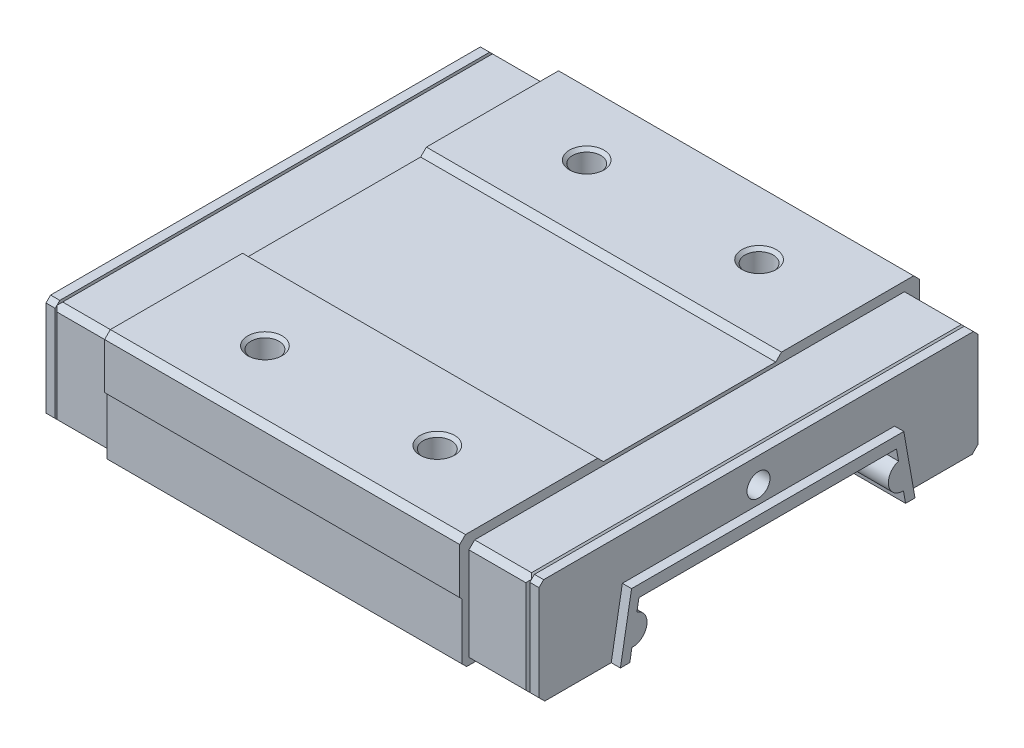
from build123d import *

# Parameters (mm, degrees)
RESSALTO_EXTRUS_O1_DEPTH      = 15.45
RESSALTO_EXTRUS_O1_DEPTH_BACK = 15.45
RESSALTO_EXTRUS_O2_DEPTH      = 6
RESSALTO_EXTRUS_O3_DEPTH      = 6
RESSALTO_EXTRUS_O4_DEPTH      = 22.25
RESSALTO_EXTRUS_O4_DEPTH_BACK = 22.25
CORTE_EXTRUS_O1_DEPTH         = 22.25
CORTE_EXTRUS_O1_DEPTH_BACK    = 22.25
ESBO_O10_W                    = 48.5
ESBO_O10_H                    = 44
CORTE_EXTRUS_O2_DEPTH         = 11
CORTE_EXTRUS_O3_DEPTH         = 20
CORTE_EXTRUS_O3_DEPTH_BACK    = 20
CORTE_EXTRUS_O4_DEPTH         = 20
CORTE_EXTRUS_O4_DEPTH_BACK    = 20
CORTE_EXTRUS_O5_DEPTH         = 10
CORTE_EXTRUS_O6_DEPTH         = 10
CORTE_EXTRUS_O7_DEPTH         = 10
CORTE_EXTRUS_O8_DEPTH         = 10
ESBO_O17_W                    = 2.5
ESBO_O17_H                    = 1
ESBO_O18_W                    = 2.5
ESBO_O18_H                    = 1


with BuildPart() as part:
    # Esboço1 → Ressalto-extrusão1 (new, two sides: drawn at the far end of the back side and taken through both)
    with BuildSketch(Plane(origin=(0, 0, 0), x_dir=(0, 0, -1), z_dir=(1, 0, 0)).offset(-RESSALTO_EXTRUS_O1_DEPTH_BACK)):
        Polygon((-20, 9.5), (-20, 5.5), (-19.8, 5.3), (-19.8, 0.4), (-19.4, 0), (19.4, 0), (19.8, 0.4), (19.8, 5.3), (20, 5.5), (20, 9.5), (19.5, 10), (8, 10), (7.5, 9.5), (-7.5, 9.5), (-8, 10), (-19.5, 10), align=None)
    extrude(amount=RESSALTO_EXTRUS_O1_DEPTH + RESSALTO_EXTRUS_O1_DEPTH_BACK)

    # Esboço2 → Ressalto-extrusão2 (add)
    with BuildSketch(Plane(origin=(-15.45, 0, 0), x_dir=(0, 0, -1), z_dir=(1, 0, 0))):
        Polygon((-19.2, 8.7), (-19.2, 0.6), (-18.6, 0), (18.6, 0), (19.2, 0.6), (19.2, 8.7), (18.7, 9.2), (-18.7, 9.2), align=None)
    extrude(amount=-RESSALTO_EXTRUS_O2_DEPTH)

    # Esboço3 → Ressalto-extrusão3 (add)
    with BuildSketch(Plane(origin=(15.45, 0, 0), x_dir=(0, 0, -1), z_dir=(1, 0, 0))):
        Polygon((-19.2, 8.7), (-19.2, 0.6), (-18.6, 0), (18.6, 0), (19.2, 0.6), (19.2, 8.7), (18.7, 9.2), (-18.7, 9.2), align=None)
    extrude(amount=RESSALTO_EXTRUS_O3_DEPTH)

    # Esboço4 → Ressalto-extrusão4 (add, two sides: drawn at the far end of the back side and taken through both)
    with BuildSketch(Plane(origin=(0, 0, 0), x_dir=(0, 0, -1), z_dir=(1, 0, 0)).offset(-RESSALTO_EXTRUS_O4_DEPTH_BACK)):
        Polygon((-12.816, 0), (12.816, 0), (11.846201606, 5.5), (-11.846201606, 5.5), align=None)
    extrude(amount=RESSALTO_EXTRUS_O4_DEPTH + RESSALTO_EXTRUS_O4_DEPTH_BACK)

    # Esboço5 → Corte-extrusão1 (cut, two sides: drawn at the far end of the back side and taken through both)
    with BuildSketch(Plane(origin=(0, 0, 0), x_dir=(0, 0, -1), z_dir=(1, 0, 0)).offset(-CORTE_EXTRUS_O1_DEPTH_BACK)):
        with BuildLine():
            Line((-12, 0), (12, 0))
            Line((12, 0), (11.814562479, 1.051668439))
            ThreePointArc((11.814562479, 1.051668439), (10.518990309, 2.082939778), (11.383714346, 3.495129625))
            Line((11.383714346, 3.495129625), (11.206528587, 4.5))
            Line((11.206528587, 4.5), (-11.206528587, 4.5))
            Line((-11.206528587, 4.5), (-11.383714346, 3.495129625))
            ThreePointArc((-11.383714346, 3.495129625), (-10.518990309, 2.082939778), (-11.814562479, 1.051668439))
            Line((-11.814562479, 1.051668439), (-12, 0))
        make_face()
    extrude(amount=CORTE_EXTRUS_O1_DEPTH + CORTE_EXTRUS_O1_DEPTH_BACK, mode=Mode.SUBTRACT)

    # Esboço6 → Corte-Revolução1 (revolve, cut)
    with BuildSketch(Plane.XY.offset(14)):
        Polygon((7.5, 10), (9, 10), (8.7295, 9.7295), (8.7295, 5.8), (7.5, 5.090147844), align=None)
    revolve(axis=Axis((7.5, 5.090147844, 14), (0, 1, 0)), mode=Mode.SUBTRACT)

    # Esboço7 → Corte-Revolução2 (revolve, cut)
    with BuildSketch(Plane.XY.offset(-14)):
        Polygon((-7.5, 10), (-6, 10), (-6.2705, 9.7295), (-6.2705, 5.8), (-7.5, 5.090147844), align=None)
    revolve(axis=Axis((-7.5, 5.090147844, -14), (0, 1, 0)), mode=Mode.SUBTRACT)

    # Esboço8 → Corte-Revolução3 (revolve, cut)
    with BuildSketch(Plane.XY.offset(14)):
        Polygon((-7.5, 10), (-6, 10), (-6.2705, 9.7295), (-6.2705, 5.8), (-7.5, 5.090147844), align=None)
    revolve(axis=Axis((-7.5, 5.090147844, 14), (0, 1, 0)), mode=Mode.SUBTRACT)

    # Esboço9 → Corte-Revolução4 (revolve, cut)
    with BuildSketch(Plane.XY.offset(-14)):
        Polygon((7.5, 10), (9, 10), (8.7295, 9.7295), (8.7295, 5.8), (7.5, 5.090147844), align=None)
    revolve(axis=Axis((7.5, 5.090147844, -14), (0, 1, 0)), mode=Mode.SUBTRACT)

    # Esboço10 → Corte-extrusão2 (cut)
    with BuildSketch(Plane(origin=(0, 0, 0), x_dir=(1, 0, 0), z_dir=(0, 1, 0))):
        Rectangle(ESBO_O10_W, ESBO_O10_H)
        Polygon((-23.25, 19.1), (-23.25, -19.1), (-20.65, -19.1), (-20.65, -21), (20.65, -21), (20.65, -19.1), (23.25, -19.1), (23.25, 19.1), (20.65, 19.1), (20.65, 21), (-20.65, 21), (-20.65, 19.1), align=None, mode=Mode.SUBTRACT)
    extrude(amount=CORTE_EXTRUS_O2_DEPTH, mode=Mode.SUBTRACT)

    # Esboço11 → Corte-extrusão3 (cut, two sides: drawn at the far end of the back side and taken through both)
    with BuildSketch(Plane.XY.offset(-CORTE_EXTRUS_O3_DEPTH_BACK)):
        Polygon((-20.65, 9.2), (-20.65, 8.95), (-20.4, 9.2), align=None)
    extrude(amount=CORTE_EXTRUS_O3_DEPTH + CORTE_EXTRUS_O3_DEPTH_BACK, mode=Mode.SUBTRACT)

    # Esboço12 → Corte-extrusão4 (cut, two sides: drawn at the far end of the back side and taken through both)
    with BuildSketch(Plane.XY.offset(-CORTE_EXTRUS_O4_DEPTH_BACK)):
        Polygon((20.4, 9.2), (20.65, 8.95), (20.65, 9.2), align=None)
    extrude(amount=CORTE_EXTRUS_O4_DEPTH + CORTE_EXTRUS_O4_DEPTH_BACK, mode=Mode.SUBTRACT)

    # Esboço13 → Corte-extrusão5 (cut)
    with BuildSketch(Plane(origin=(0, 0, 0), x_dir=(1, 0, 0), z_dir=(0, 1, 0))):
        Polygon((-20.65, 19.2), (-20.65, 18.95), (-20.4, 19.2), align=None)
    extrude(amount=CORTE_EXTRUS_O5_DEPTH, mode=Mode.SUBTRACT)

    # Esboço14 → Corte-extrusão6 (cut)
    with BuildSketch(Plane(origin=(0, 0, 0), x_dir=(1, 0, 0), z_dir=(0, 1, 0))):
        Polygon((-20.65, -19.2), (-20.4, -19.2), (-20.65, -18.95), align=None)
    extrude(amount=CORTE_EXTRUS_O6_DEPTH, mode=Mode.SUBTRACT)

    # Esboço15 → Corte-extrusão7 (cut)
    with BuildSketch(Plane(origin=(0, 0, 0), x_dir=(1, 0, 0), z_dir=(0, 1, 0))):
        Polygon((20.4, 19.2), (20.65, 18.95), (20.65, 19.2), align=None)
    extrude(amount=CORTE_EXTRUS_O7_DEPTH, mode=Mode.SUBTRACT)

    # Esboço16 → Corte-extrusão8 (cut)
    with BuildSketch(Plane(origin=(0, 0, 0), x_dir=(1, 0, 0), z_dir=(0, 1, 0))):
        Polygon((20.4, -19.2), (20.65, -19.2), (20.65, -18.95), align=None)
    extrude(amount=CORTE_EXTRUS_O8_DEPTH, mode=Mode.SUBTRACT)

    # Esboço17 → Corte-Revolução5 (revolve, cut)
    with BuildSketch(Plane.XY):
        with Locations((-20.2, 7.5)):
            Rectangle(ESBO_O17_W, ESBO_O17_H)
    revolve(axis=Axis((-18.95, 7, 0), (-1, 0, 0)), mode=Mode.SUBTRACT)

    # Esboço18 → Corte-Revolução6 (revolve, cut)
    with BuildSketch(Plane.XY):
        with Locations((20.2, 7.5)):
            Rectangle(ESBO_O18_W, ESBO_O18_H)
    revolve(axis=Axis((21.45, 7, 0), (-1, 0, 0)), mode=Mode.SUBTRACT)


solid = part.part
